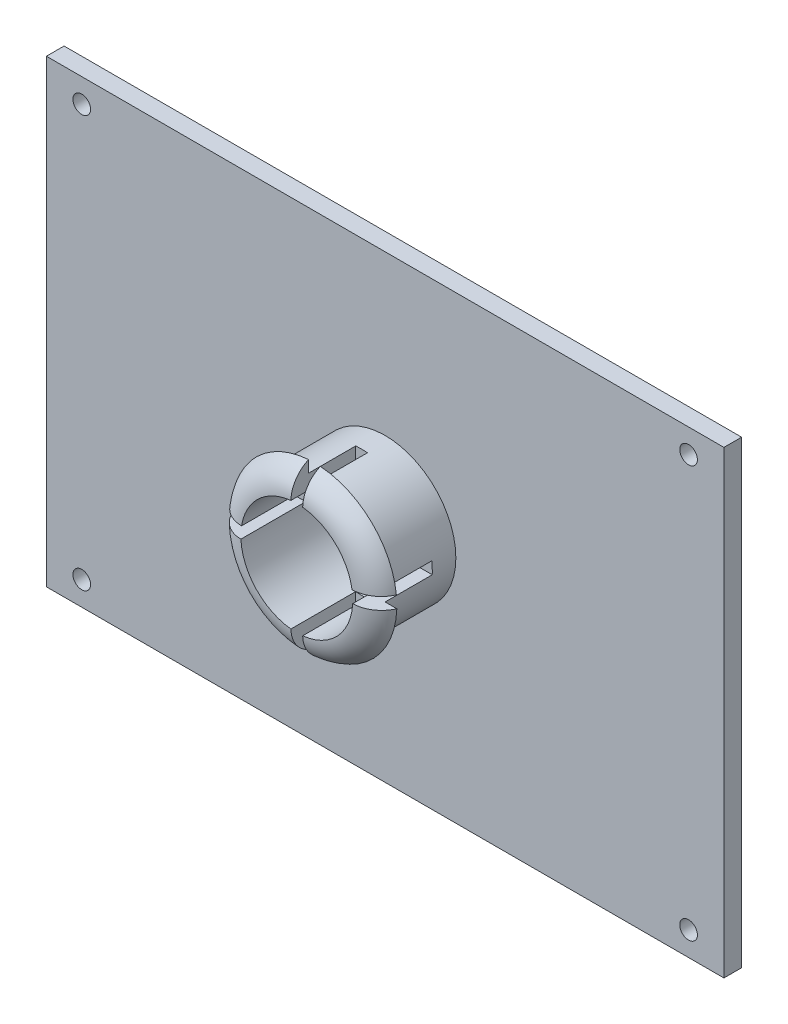
from build123d import *

# Parameters (mm, degrees)
ESBO_O1_R                      = 12
ESBO_O1_R_2                    = 9.5
RESSALTO_EXTRUS_O1_DEPTH       = 12
RESSALTO_EXTRUS_O2_START       = 12
RESSALTO_EXTRUS_O2_OUTLINE_R   = 13.990411925
RESSALTO_EXTRUS_O2_OUTLINE_R_2 = 9.5
RESSALTO_EXTRUS_O2_DEPTH       = 3
CORTE_EXTRUS_O1_DEPTH          = 17
CORTE_EXTRUS_O1_DEPTH_BACK     = 19
ESBO_O2_W                      = 17.351165954
ESBO_O2_H                      = 2
CORTE_EXTRUS_O2_DEPTH          = 19
CORTE_EXTRUS_O2_DEPTH_BACK     = 19
ESBO_O3_W                      = 2
ESBO_O3_H                      = 13.611936421
FILETE1_R                      = 5
FILETE2_R                      = 5
FILETE3_R                      = 5
FILETE4_R                      = 5
RESSALTO_EXTRUS_O3_START       = 3
F_3DSKETCH3_R                  = 9.5
RESSALTO_EXTRUS_O3_DEPTH       = 3
CORTE_EXTRUS_O3_DEPTH          = 14
CORTE_EXTRUS_O3_DEPTH_BACK     = 63
F_3DSKETCH4_R                  = 1.5


with BuildPart() as part:
    # Esboço1 → Ressalto-extrusão1 (new body)
    with BuildSketch(Plane.XY):
        Circle(ESBO_O1_R)
        Circle(ESBO_O1_R_2, mode=Mode.SUBTRACT)
    extrude(amount=RESSALTO_EXTRUS_O1_DEPTH)

    # Ressalto-extrusão2: read off the stored shape, not the designer's step
    # Ressalto-extrusão2 outline → Ressalto-extrusão2 (add)
    with BuildSketch(Plane.XY.offset(RESSALTO_EXTRUS_O2_START)):
        Circle(RESSALTO_EXTRUS_O2_OUTLINE_R)
        Circle(RESSALTO_EXTRUS_O2_OUTLINE_R_2, mode=Mode.SUBTRACT)
    extrude(amount=RESSALTO_EXTRUS_O2_DEPTH)

    # Esboço2 → Corte-extrusão1 (cut, two sides: drawn at the far end of the back side and taken through both)
    with BuildSketch(Plane(origin=(0, 0, 0), x_dir=(0, 0, -1), z_dir=(1, 0, 0)).offset(-CORTE_EXTRUS_O1_DEPTH_BACK)):
        with Locations((-12.675582977, 0.519294875)):
            Rectangle(ESBO_O2_W, ESBO_O2_H)
    extrude(amount=CORTE_EXTRUS_O1_DEPTH + CORTE_EXTRUS_O1_DEPTH_BACK, mode=Mode.SUBTRACT)

    # Esboço3 → Corte-extrusão2 (cut, two sides: drawn at the far end of the back side and taken through both)
    with BuildSketch(Plane(origin=(0, 0, 0), x_dir=(1, 0, 0), z_dir=(0, 1, 0)).offset(-CORTE_EXTRUS_O2_DEPTH_BACK)):
        with Locations((0, -10.80596821)):
            Rectangle(ESBO_O3_W, ESBO_O3_H)
    extrude(amount=CORTE_EXTRUS_O2_DEPTH + CORTE_EXTRUS_O2_DEPTH_BACK, mode=Mode.SUBTRACT)

    # Filete1
    # the kernel refuses this fillet: 5 mm, written as the material it takes off along each edge
    with BuildSketch(Plane(origin=(0, 0, 15), x_dir=(0.7581495843682223, -0.6520806757773855, 0), z_dir=(-0.6520806757773855, -0.7581495843682223, 0))) as filete1_piece_1_section:
        with BuildLine():
            CenterArc((9.40783623, -5), FILETE1_R, 23.578178478, 66.421821522)
            Line((9.40783623, 0), (13.990411925, 0))
            Line((13.990411925, 0), (13.990411925, -3))
        make_face()
    filete1_piece_1 = revolve(axis=Axis((0, 0, 15), (0, 0, 1)), revolution_arc=173.532819647, mode=Mode.PRIVATE)
    filete1_piece_1 = split(filete1_piece_1, bisect_by=Plane(origin=(1, 0, 15), z_dir=(1, 0, 0)), keep=Keep.TOP, mode=Mode.PRIVATE)
    filete1_piece_1 = split(filete1_piece_1, bisect_by=Plane(origin=(0, 1.519294875, 15), z_dir=(0, 1, 0)), keep=Keep.TOP, mode=Mode.PRIVATE)
    add(filete1_piece_1, mode=Mode.SUBTRACT)

    # Filete2
    # the kernel refuses this fillet: 5 mm, written as the material it takes off along each edge
    with BuildSketch(Plane(origin=(0, 0, 15), x_dir=(-0.679899413949249, -0.7333053844828004, 0), z_dir=(-0.7333053844828004, 0.679899413949249, 0))) as filete2_piece_1_section:
        with BuildLine():
            CenterArc((9.40783623, -5), FILETE2_R, 23.578178478, 66.421821522)
            Line((13.990411925, -3), (13.990411925, 0))
            Line((13.990411925, 0), (9.40783623, 0))
        make_face()
    filete2_piece_1 = revolve(axis=Axis((0, 0, 15), (0, 0, 1)), revolution_arc=177.801374174, mode=Mode.PRIVATE)
    filete2_piece_1 = split(filete2_piece_1, bisect_by=Plane(origin=(-1, 0, 15), z_dir=(1, 0, 0)), keep=Keep.TOP, mode=Mode.PRIVATE)
    add(filete2_piece_1, mode=Mode.SUBTRACT)

    # Filete3
    # the kernel refuses this fillet: 5 mm, written as the material it takes off along each edge
    with BuildSketch(Plane(origin=(0, 0, 15), x_dir=(-0.7075313095917145, 0.7066819977524781, 0), z_dir=(0.7066819977524781, 0.7075313095917145, 0))) as filete3_piece_1_section:
        with BuildLine():
            CenterArc((9.40783623, -5), FILETE3_R, 23.578178478, 66.421821522)
            Line((13.990411925, -3), (13.990411925, 0))
            Line((13.990411925, 0), (9.40783623, 0))
        make_face()
    filete3_piece_1 = revolve(axis=Axis((0, 0, 15), (0, 0, 1)), revolution_arc=177.801374174, mode=Mode.PRIVATE)
    filete3_piece_1 = split(filete3_piece_1, bisect_by=Plane(origin=(0, -0.480705125, 15), z_dir=(0, -1, 0)), keep=Keep.TOP, mode=Mode.PRIVATE)
    add(filete3_piece_1, mode=Mode.SUBTRACT)

    # Filete4
    # the kernel refuses this fillet: 5 mm, written as the material it takes off along each edge
    with BuildSketch(Plane(origin=(0, 0, 15), x_dir=(0.6677059228451385, 0.744425147746583, 0), z_dir=(0.744425147746583, -0.6677059228451385, 0))) as filete4_piece_1:
        with BuildLine():
            CenterArc((9.407462566, -4.999143609), FILETE4_R, 23.567471489, 65.372067079)
            Line((13.990411925, -3), (14.082070912, -2.960017128))
            ThreePointArc((14.082070912, -2.960017128), (14.090411925, -1.5), (14.090411925, 0))
            Line((14.090411925, 0), (13.990411925, 0.1))
            ThreePointArc((13.990411925, 0.1), (11.745205963, 0.1), (9.501850749, 0.099982872))
            Line((9.501850749, 0.099982872), (9.5, 0))
        make_face()
    revolve(axis=Axis((0, 0, 15), (0, 0, 1)), revolution_arc=171.645006374, mode=Mode.SUBTRACT)

    # 3DSketch3 → Ressalto-extrusão3 (add)
    with BuildSketch(Plane(origin=(57.5, 39, 0), x_dir=(-0.8275951732462348, -0.5613254218539678, 0), z_dir=(0, 0, -1)).offset(RESSALTO_EXTRUS_O3_START)):
        Polygon((0, 0), (95.173444923, 64.552423513), (138.956827828, 0), (43.783382905, -64.552423513), align=None)
        with Locations(Location((69.478413914, 0, 0), (0, 0, 31.247073166))):
            Circle(F_3DSKETCH3_R, mode=Mode.SUBTRACT)
    extrude(amount=-RESSALTO_EXTRUS_O3_DEPTH)

    # 3DSketch4 → Corte-extrusão3 (cut, two sides: drawn at the far end of the back side and taken through both)
    with BuildSketch(Plane(origin=(51.5, 34.930434783, -3), x_dir=(-0.8275951732462347, -0.5613254218539678, 0), z_dir=(0, 0, 1)).offset(-CORTE_EXTRUS_O3_DEPTH_BACK)):
        with Locations(Location((0, 0, 0), (0, 0, 145.85249086))):
            Circle(F_3DSKETCH4_R)
        with Locations(Location((39.21468208, 57.816518451, 0), (0, 0, 145.85249086))):
            Circle(F_3DSKETCH4_R)
        with Locations(Location((124.456984924, 0, 0), (0, 0, 145.85249086))):
            Circle(F_3DSKETCH4_R)
        with Locations(Location((85.242302844, -57.816518451, 0), (0, 0, 145.85249086))):
            Circle(F_3DSKETCH4_R)
    extrude(amount=CORTE_EXTRUS_O3_DEPTH + CORTE_EXTRUS_O3_DEPTH_BACK, mode=Mode.SUBTRACT)


solid = part.part
